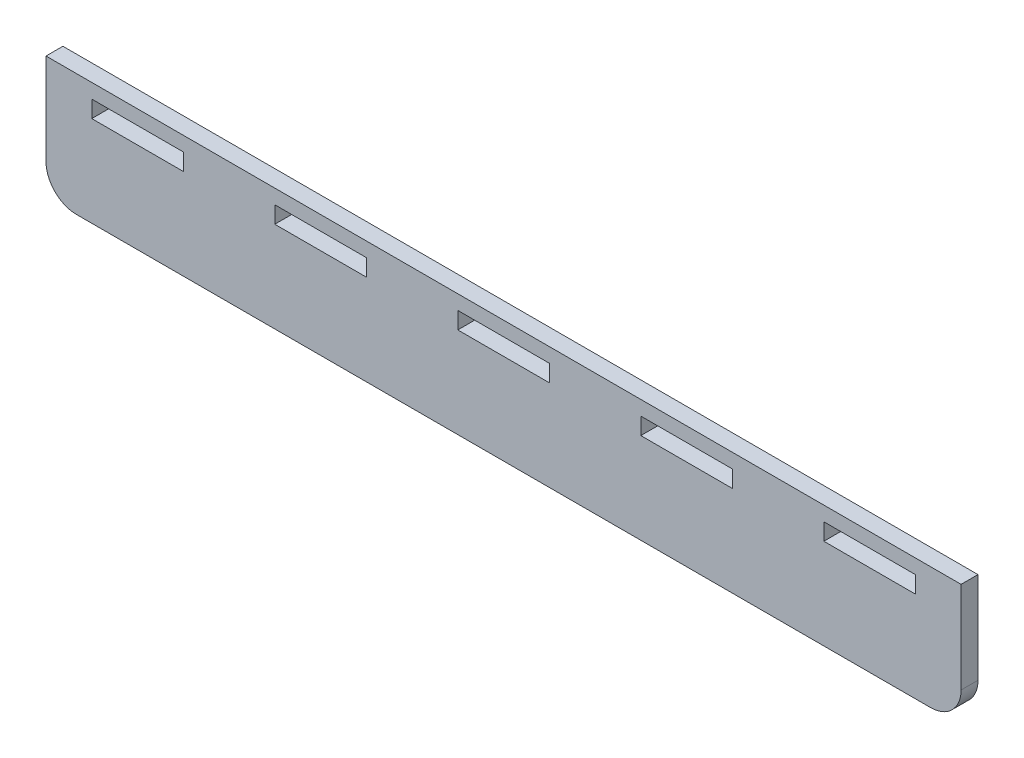
from build123d import *

# Parameters (mm, degrees)
SKETCH2_W           = 300
SKETCH2_H           = 40
SKETCH2_W_2         = 30
SKETCH2_H_2         = 5.54
BOSS_EXTRUDE1_DEPTH = 5.54
FILLET1_R           = 10


with BuildPart() as part:
    # Sketch2 → Boss-Extrude1 (new body)
    with BuildSketch(Plane.XY):
        with Locations((209.474602118, -4.853960239)):
            Rectangle(SKETCH2_W, SKETCH2_H)
        with Locations((209.474602118, 7.646039761)):
            Rectangle(SKETCH2_W_2, SKETCH2_H_2, mode=Mode.SUBTRACT)
        with Locations((89.474602118, 7.646039761)):
            Rectangle(SKETCH2_W_2, SKETCH2_H_2, mode=Mode.SUBTRACT)
        with Locations((149.474602118, 7.646039761)):
            Rectangle(SKETCH2_W_2, SKETCH2_H_2, mode=Mode.SUBTRACT)
        with Locations((329.474602118, 7.646039761)):
            Rectangle(SKETCH2_W_2, SKETCH2_H_2, mode=Mode.SUBTRACT)
        with Locations((269.474602118, 7.646039761)):
            Rectangle(SKETCH2_W_2, SKETCH2_H_2, mode=Mode.SUBTRACT)
    extrude(amount=BOSS_EXTRUDE1_DEPTH)

    # Fillet1
    fillet1_edges = [part.edges().sort_by_distance(p)[0] for p in [
        (359.474602118, -24.853960239, 2.77),
        (59.474602118, -24.853960239, 2.77),
    ]]
    fillet(fillet1_edges, radius=FILLET1_R)


solid = part.part
